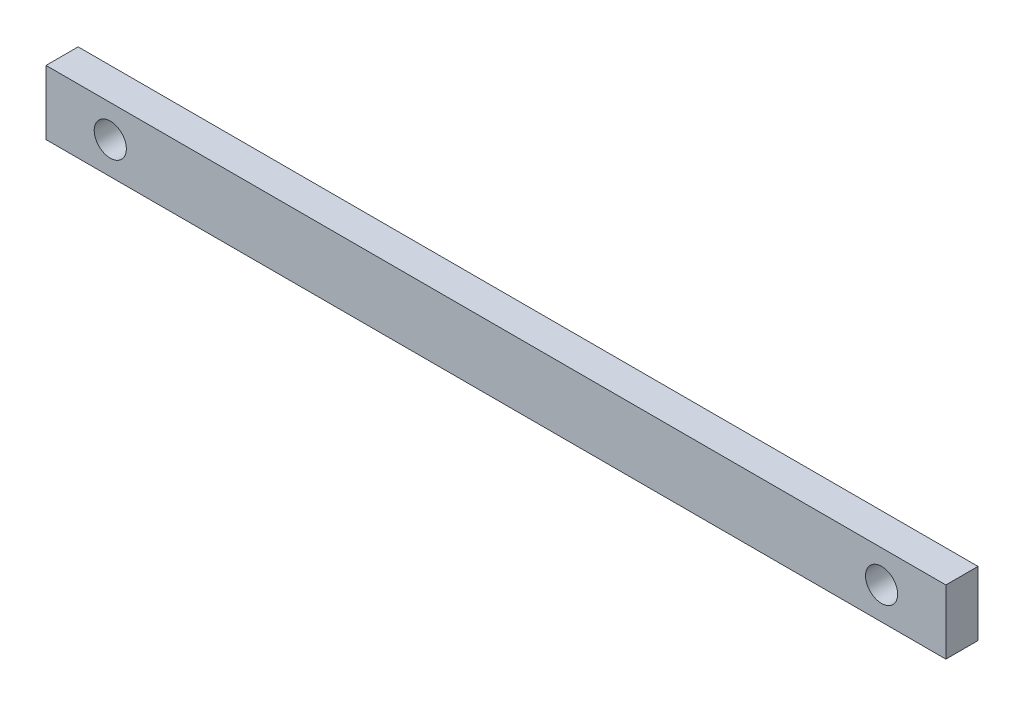
from build123d import *

# Parameters (mm, degrees)
SKETCH1_W           = 280
SKETCH1_H           = 10
BOSS_EXTRUDE1_DEPTH = 20
SKETCH2_R           = 5
CUT_EXTRUDE1_DEPTH  = 56


with BuildPart() as part:
    # Sketch1 → Boss-Extrude1 (new body)
    with BuildSketch(Plane(origin=(0, 0, 0), x_dir=(1, 0, 0), z_dir=(0, 1, 0))):
        with Locations((140, 5)):
            Rectangle(SKETCH1_W, SKETCH1_H)
    extrude(amount=BOSS_EXTRUDE1_DEPTH)

    # Sketch2 → Cut-Extrude1 (cut)
    with BuildSketch(Plane.XY):
        with Locations((20, 10)):
            Circle(SKETCH2_R)
        with Locations((260, 10)):
            Circle(SKETCH2_R)
    extrude(amount=-CUT_EXTRUDE1_DEPTH, mode=Mode.SUBTRACT)


solid = part.part
